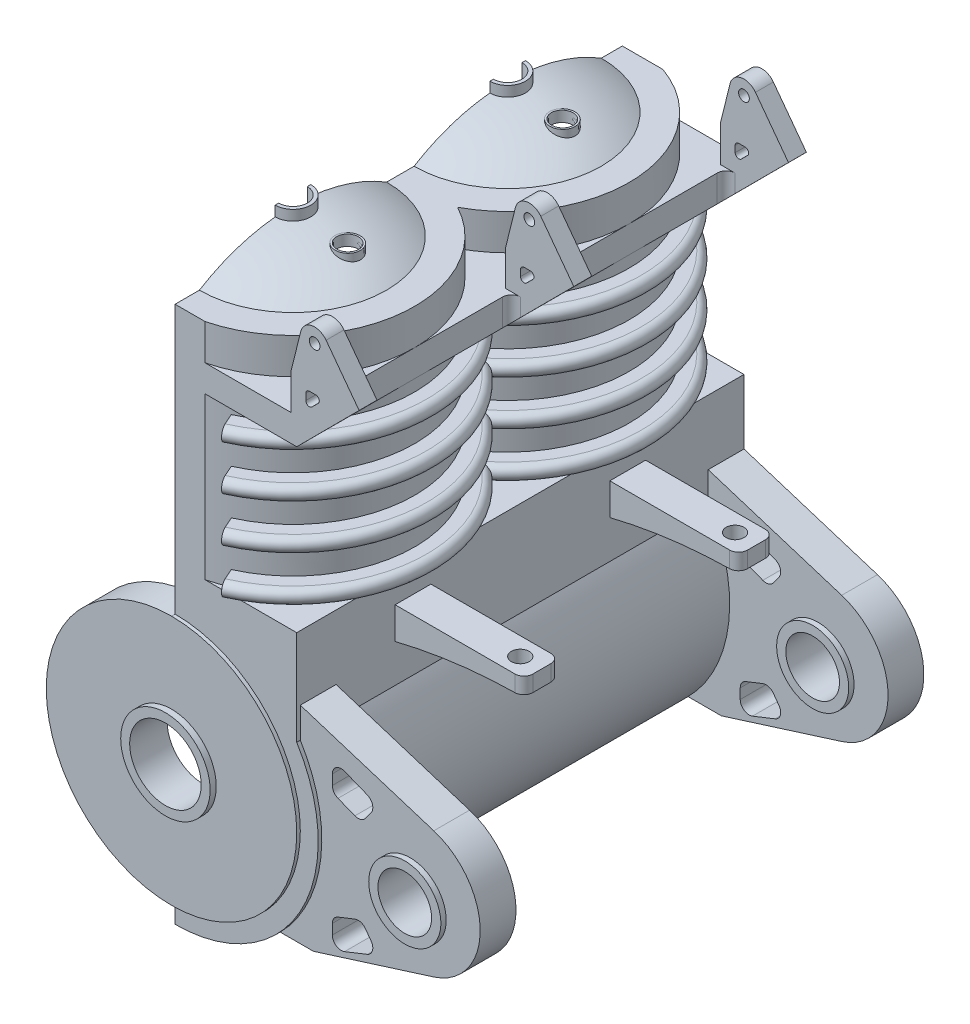
from build123d import *

# Parameters (mm, degrees)
BOSS_EXTRUDE1_DEPTH     = 25
SKETCH2_R               = 5
CUT_EXTRUDE1_DEPTH      = 20
SKETCH3_R               = 7
CUT_EXTRUDE2_DEPTH      = 39.394275615
CUT_EXTRUDE3_DEPTH      = 9
REVOLVE1_ANGLE          = 156
LPATTERN1_COUNT         = 2
LPATTERN1_PITCH         = 12
SKETCH6_R               = 5
CUT_EXTRUDE4_DEPTH      = 19
BOSS_EXTRUDE3_START     = -1
SKETCH7_R               = 7.001070091
SKETCH7_R_2             = 2.5
BOSS_EXTRUDE3_DEPTH     = 1.5
LPATTERN2_COUNT         = 3
LPATTERN2_PITCH         = 12
BOSS_EXTRUDE4_START     = 0.2
SKETCH8_R               = 2.5
BOSS_EXTRUDE4_DEPTH     = 0.2
BOSS_EXTRUDE5_START     = -1.6
SKETCH9_R               = 2.5
SKETCH9_R_2             = 2
BOSS_EXTRUDE5_DEPTH     = 2.1
LPATTERN3_COUNT         = 3
LPATTERN3_PITCH         = 12.22
BOSS_EXTRUDE6_START     = 2
BOSS_EXTRUDE6_DEPTH     = 2
SKETCH11_R              = 2.015
BOSS_EXTRUDE7_DEPTH     = 2
LPATTERN4_COUNT         = 2
LPATTERN4_PITCH         = 22.8
BOSS_EXTRUDE8_START     = 0.3
SKETCH12_R              = 2.015
SKETCH12_R_2            = 1.5
BOSS_EXTRUDE8_DEPTH     = 2.6
LPATTERN5_COUNT         = 2
LPATTERN5_PITCH         = 22.8
CUT_EXTRUDE5_DEPTH      = 43.908131966
CUT_EXTRUDE5_DEPTH_BACK = 43.908131966
REVOLVE2_ANGLE          = 180
LPATTERN6_COUNT         = 2
LPATTERN6_PITCH         = 12
SKETCH15_R              = 0.995
CUT_EXTRUDE6_DEPTH      = 43.908131896
BOSS_EXTRUDE9_START     = 1.2
BOSS_EXTRUDE9_DEPTH     = 0.8
SKETCH17_R              = 0.6
CUT_EXTRUDE7_DEPTH      = 10.8
SKETCH19_R              = 0.3
BOSS_EXTRUDE10_DEPTH    = 1
LPATTERN7_COUNT         = 3
LPATTERN7_PITCH         = 12
FILLET1_R               = 0.5
BOSS_EXTRUDE11_START    = -5.5
BOSS_EXTRUDE11_DEPTH    = 2
LPATTERN8_COUNT         = 2
LPATTERN8_PITCH         = 12
SKETCH21_R              = 0.5
CUT_EXTRUDE8_DEPTH      = 2
FILLET2_R               = 0.5
SKETCH22_W              = 4.85898412
SKETCH22_H              = 1.483894479
CUT_EXTRUDE9_DEPTH      = 45.833483211
SKETCH23_R              = 0.3
BOSS_EXTRUDE12_DEPTH    = 1
LPATTERN9_COUNT         = 3
LPATTERN9_PITCH         = 12
EXTRUDE_THIN1_START     = 0.6
EXTRUDE_THIN1_DEPTH     = 0.6


# Read off the part's stored shape, not the designer's step: Extrude-Thin1
with BuildPart() as part:
    # Sketch1 → Boss-Extrude1 (new body)
    with BuildSketch(Plane.XY):
        with BuildLine():
            Line((0, 28.02), (0, 0))
            ThreePointArc((0, 0), (6.989781542, 4.108605135), (6.8, 12.214261501))
            Line((6.8, 12.214261501), (6.8, 28.02))
            Line((6.8, 28.02), (0, 28.02))
        make_face()
    extrude(amount=BOSS_EXTRUDE1_DEPTH)

    # Sketch2 → Cut-Extrude1 (cut)
    with BuildSketch(Plane(origin=(0, 28.02, 0), x_dir=(1, 0, 0), z_dir=(0, 1, 0))):
        with Locations((0, -6.41)):
            Circle(SKETCH2_R)
        with Locations((0, -18.41)):
            Circle(SKETCH2_R)
    extrude(amount=-CUT_EXTRUDE1_DEPTH, mode=Mode.SUBTRACT)

    # Sketch3 → Cut-Extrude2 (cut, through all)
    with BuildSketch(Plane.XY.offset(25)):
        with Locations((0, 8.02)):
            Circle(SKETCH3_R)
    extrude(amount=-CUT_EXTRUDE2_DEPTH, mode=Mode.SUBTRACT)

    # Sketch4 → Cut-Extrude3 (cut)
    with BuildSketch(Plane(origin=(0, 26.52, 0), x_dir=(1, 0, 0), z_dir=(0, 1, 0))):
        with BuildLine():
            Line((0, 0.39), (13.311455152, 0.39))
            Line((13.311455152, 0.39), (13.311455152, -25.21))
            Line((13.311455152, -25.21), (0, -25.21))
            ThreePointArc((0, -25.21), (6.596969001, -20.05924225), (3.2, -12.41))
            ThreePointArc((3.2, -12.41), (6.596969001, -4.76075775), (0, 0.39))
        make_face()
    extrude(amount=-CUT_EXTRUDE3_DEPTH, mode=Mode.SUBTRACT)

    # Sketch5 → Revolve1 (revolve)
    with BuildSketch(Plane.ZY):
        with BuildLine():
            Line((0.17, 25.07), (0.17, 25.87))
            Line((0.17, 25.87), (-1.07, 25.87))
            ThreePointArc((-1.07, 25.87), (-1.47, 25.47), (-1.07, 25.07))
            Line((-1.07, 25.07), (0.17, 25.07))
        make_face()
        with BuildLine():
            Line((0.17, 22.57), (0.17, 23.37))
            Line((0.17, 23.37), (-1.07, 23.37))
            ThreePointArc((-1.07, 23.37), (-1.47, 22.97), (-1.07, 22.57))
            Line((-1.07, 22.57), (0.17, 22.57))
        make_face()
        with BuildLine():
            Line((-1.07, 17.57), (0.17, 17.57))
            Line((0.17, 17.57), (0.17, 18.37))
            Line((0.17, 18.37), (-1.07, 18.37))
            ThreePointArc((-1.07, 18.37), (-1.47, 17.97), (-1.07, 17.57))
        make_face()
        with BuildLine():
            Line((0.17, 20.07), (0.17, 20.87))
            Line((0.17, 20.87), (-1.07, 20.87))
            ThreePointArc((-1.07, 20.87), (-1.47, 20.47), (-1.07, 20.07))
            Line((-1.07, 20.07), (0.17, 20.07))
        make_face()
    revolve1 = revolve(axis=Axis((0, 28.02, 6.41), (0, -1, 0)), revolution_arc=REVOLVE1_ANGLE)

    # LPattern1: Revolve1 ×2
    with Locations(*[(0, 0, i * LPATTERN1_PITCH) for i in range(1, LPATTERN1_COUNT)]):
        add(revolve1)

    # Sketch6 → Cut-Extrude4 (cut)
    with BuildSketch(Plane(origin=(0, 28.02, 0), x_dir=(1, 0, 0), z_dir=(0, 1, 0))):
        with Locations((0, -6.41)):
            Circle(SKETCH6_R)
    extrude(amount=-CUT_EXTRUDE4_DEPTH, mode=Mode.SUBTRACT)

    # Sketch7 → Boss-Extrude3 (add)
    with BuildSketch(Plane(origin=(0, 0, 0), x_dir=(-1, 0, 0), z_dir=(0, 0, -1)).offset(BOSS_EXTRUDE3_START)):
        with Locations((0, 8.02)):
            Circle(SKETCH7_R)
        with Locations((0, 8.02)):
            Circle(SKETCH7_R_2, mode=Mode.SUBTRACT)
    boss_extrude3 = extrude(amount=BOSS_EXTRUDE3_DEPTH)

    # LPattern2: Boss-Extrude3 ×3
    with Locations(*[(0, 0, i * LPATTERN2_PITCH) for i in range(1, LPATTERN2_COUNT)]):
        add(boss_extrude3)

    # Sketch8 → Boss-Extrude4 (add)
    with BuildSketch(Plane.XY.offset(25).offset(BOSS_EXTRUDE4_START)):
        with BuildLine():
            Line((0, 15.02), (0, 15.021070091))
            ThreePointArc((0, 15.021070091), (-7.001070091, 8.02), (0, 1.018929909))
            Line((0, 1.018929909), (0, 1.02))
            ThreePointArc((0, 1.02), (7, 8.02), (0, 15.02))
        make_face()
        with Locations(Location((0, 8.02, 0), (0, 0, 180))):
            Circle(SKETCH8_R, mode=Mode.SUBTRACT)
    extrude(amount=-BOSS_EXTRUDE4_DEPTH)

    # Sketch9 → Boss-Extrude5 (add)
    with BuildSketch(Plane(origin=(0, 0, -0.5), x_dir=(-1, 0, 0), z_dir=(0, 0, -1)).offset(BOSS_EXTRUDE5_START)):
        with Locations((0, 8.02)):
            Circle(SKETCH9_R)
        with Locations((0, 8.02)):
            Circle(SKETCH9_R_2, mode=Mode.SUBTRACT)
    boss_extrude5 = extrude(amount=BOSS_EXTRUDE5_DEPTH)

    # LPattern3: Boss-Extrude5 ×3
    with Locations(*[(0, 0, i * LPATTERN3_PITCH) for i in range(1, LPATTERN3_COUNT)]):
        add(boss_extrude5)

    # Sketch10 → Boss-Extrude6 (add)
    with BuildSketch(Plane(origin=(0, 28.02, 0), x_dir=(1, 0, 0), z_dir=(0, 1, 0)).offset(BOSS_EXTRUDE6_START)):
        with BuildLine():
            Line((0, -13.41), (0, -11.41))
            ThreePointArc((0, -11.41), (5, -6.41), (0, -1.41))
            Line((0, -1.41), (0, 0))
            Line((0, 0), (2.269779725, 0))
            ThreePointArc((2.269779725, 0), (5.553129844, -2.485366395), (6.8, -6.41))
            ThreePointArc((6.8, -6.41), (5.830951895, -9.908571137), (3.2, -12.41))
            ThreePointArc((3.2, -12.41), (5.830951895, -14.911428863), (6.8, -18.41))
            ThreePointArc((6.8, -18.41), (5.368553353, -22.583563813), (1.676872088, -25))
            Line((1.676872088, -25), (0, -25))
            Line((0, -25), (0, -23.41))
            ThreePointArc((0, -23.41), (5, -18.41), (0, -13.41))
        make_face()
    extrude(amount=-BOSS_EXTRUDE6_DEPTH)

    # Sketch11 → Boss-Extrude7 (add)
    with BuildSketch(Plane(origin=(0, 0, 0), x_dir=(-1, 0, 0), z_dir=(0, 0, -1))):
        with BuildLine():
            Line((-6.8, 13.910696928), (-14.260881942, 11.558289887))
            ThreePointArc((-14.260881942, 11.558289887), (-16.855263426, 8.02), (-14.260881942, 4.481710113))
            Line((-14.260881942, 4.481710113), (-7.534562688, 2.360909798))
            Line((-7.534562688, 2.360909798), (-5.674562688, 2.360909798))
            ThreePointArc((-5.674562688, 2.360909798), (-7.948321427, 7.092152825), (-6.8, 12.214261501))
            Line((-6.8, 12.214261501), (-6.8, 13.910696928))
        make_face()
        with Locations((-12.94, 7.58)):
            Circle(SKETCH11_R, mode=Mode.SUBTRACT)
    boss_extrude7 = extrude(amount=-BOSS_EXTRUDE7_DEPTH)

    # LPattern4: Boss-Extrude7 ×2
    with Locations(*[(0, 0, i * LPATTERN4_PITCH) for i in range(1, LPATTERN4_COUNT)]):
        add(boss_extrude7)

    # Sketch12 → Boss-Extrude8 (add)
    with BuildSketch(Plane(origin=(0, 0, 0), x_dir=(-1, 0, 0), z_dir=(0, 0, -1)).offset(BOSS_EXTRUDE8_START)):
        with Locations((-12.94, 7.58)):
            Circle(SKETCH12_R)
        with Locations((-12.94, 7.58)):
            Circle(SKETCH12_R_2, mode=Mode.SUBTRACT)
    boss_extrude8 = extrude(amount=-BOSS_EXTRUDE8_DEPTH)

    # LPattern5: Boss-Extrude8 ×2
    with Locations(*[(0, 0, i * LPATTERN5_PITCH) for i in range(1, LPATTERN5_COUNT)]):
        add(boss_extrude8)

    # Sketch13 → Cut-Extrude5 (cut, two sides: drawn at the far end of the back side and taken through both)
    with BuildSketch(Plane(origin=(0, 0, 0), x_dir=(-1, 0, 0), z_dir=(0, 0, -1)).offset(-CUT_EXTRUDE5_DEPTH_BACK)):
        with BuildLine():
            Line((-9.274539991, 11.944182233), (-10.537427013, 11.44237282))
            ThreePointArc((-10.537427013, 11.44237282), (-10.833332956, 11.115847458), (-10.755995772, 10.68202941))
            Line((-10.755995772, 10.68202941), (-10.438459449, 10.249025334))
            ThreePointArc((-10.438459449, 10.249025334), (-10.173708226, 10.064258163), (-9.851232726, 10.079803859))
            Line((-9.851232726, 10.079803859), (-8.905882026, 10.454005178))
            ThreePointArc((-8.905882026, 10.454005178), (-8.676377466, 10.637849872), (-8.589906252, 10.918908484))
            Line((-8.589906252, 10.918908484), (-8.589906252, 11.479520655))
            ThreePointArc((-8.589906252, 11.479520655), (-8.80911885, 11.893233641), (-9.274539991, 11.944182233))
        make_face()
        with BuildLine():
            Line((-10.755995772, 4.47797059), (-10.438459449, 4.910974666))
            ThreePointArc((-10.438459449, 4.910974666), (-10.173708226, 5.095741837), (-9.851232726, 5.080196141))
            Line((-9.851232726, 5.080196141), (-8.905882026, 4.705994822))
            ThreePointArc((-8.905882026, 4.705994822), (-8.676377466, 4.522150128), (-8.589906252, 4.241091516))
            Line((-8.589906252, 4.241091516), (-8.589906252, 3.680479345))
            ThreePointArc((-8.589906252, 3.680479345), (-8.80911885, 3.266766359), (-9.274539991, 3.215817767))
            Line((-9.274539991, 3.215817767), (-10.537427013, 3.71762718))
            ThreePointArc((-10.537427013, 3.71762718), (-10.833332956, 4.044152542), (-10.755995772, 4.47797059))
        make_face()
    extrude(amount=CUT_EXTRUDE5_DEPTH + CUT_EXTRUDE5_DEPTH_BACK, mode=Mode.SUBTRACT)

    # Sketch14 → Revolve2 (revolve)
    with BuildSketch(Plane.ZY):
        with BuildLine():
            Line((18.41, 31.498591666), (18.41, 31.378591666))
            ThreePointArc((18.41, 31.378591666), (15.819354747, 31.032895897), (13.41, 30.02))
            Line((13.41, 30.02), (13.176874739, 30.02))
            ThreePointArc((13.176874739, 30.02), (15.691000491, 31.121846919), (18.41, 31.498591666))
        make_face()
    revolve2 = revolve(axis=Axis((0, 30.02, 18.41), (0, -1, 0)), revolution_arc=REVOLVE2_ANGLE)

    # LPattern6: Revolve2 ×2
    with Locations(*[(0, 0, -i * LPATTERN6_PITCH) for i in range(1, LPATTERN6_COUNT)]):
        add(revolve2)

    # Sketch15 → Cut-Extrude6 (cut, through all)
    with BuildSketch(Plane(origin=(0, 30.02, 0), x_dir=(1, 0, 0), z_dir=(0, 1, 0))):
        with Locations((0, -6.41)):
            Circle(SKETCH15_R)
        with Locations((0, -18.41)):
            Circle(SKETCH15_R)
    extrude(amount=CUT_EXTRUDE6_DEPTH, mode=Mode.SUBTRACT)

    # Sketch16 → Boss-Extrude9 (add)
    with BuildSketch(Plane(origin=(0, 30.02, 0), x_dir=(1, 0, 0), z_dir=(0, 1, 0)).offset(BOSS_EXTRUDE9_START)):
        with BuildLine():
            Line((0, -5.415), (0, -5.61))
            ThreePointArc((0, -5.61), (0.8, -6.41), (0, -7.21))
            Line((0, -7.21), (0, -7.405))
            ThreePointArc((0, -7.405), (0.995, -6.41), (0, -5.415))
        make_face()
        with BuildLine():
            Line((0, -19.405), (0, -19.21))
            ThreePointArc((0, -19.21), (0.8, -18.41), (0, -17.61))
            Line((0, -17.61), (0, -17.415))
            ThreePointArc((0, -17.415), (0.995, -18.41), (0, -19.405))
        make_face()
    extrude(amount=BOSS_EXTRUDE9_DEPTH)

    # Sketch17 → Cut-Extrude7 (cut)
    with BuildSketch(Plane(origin=(14.781964373, 17.616459147, 0), x_dir=(0, 0, 1), z_dir=(0.6427876096865406, 0.7660444431189771, -1.5357894129670808e-14))):
        with Locations(Location((6.41, -17.582059262, 0), (0, 0, 242.728829359))):
            Circle(SKETCH17_R)
        with Locations(Location((18.41, -17.582059262, 0), (0, 0, 242.728829359))):
            Circle(SKETCH17_R)
    extrude(amount=CUT_EXTRUDE7_DEPTH, mode=Mode.SUBTRACT)

    # Sketch19 → Boss-Extrude10 (add)
    with BuildSketch(Plane(origin=(0, 0, 0), x_dir=(-1, 0, 0), z_dir=(0, 0, -1))):
        with BuildLine():
            Line((-6.48, 30.02), (-6.48, 26.52))
            Line((-6.48, 26.52), (-6.8, 26.52))
            Line((-6.8, 26.52), (-10.769623837, 30.504747406))
            ThreePointArc((-10.769623837, 30.504747406), (-10.666737998, 31.247185622), (-9.924299782, 31.144299782))
            Line((-9.924299782, 31.144299782), (-8.8, 30.02))
            Line((-8.8, 30.02), (-6.48, 30.02))
        make_face()
        with Locations((-10.34696181, 30.824523594)):
            Circle(SKETCH19_R, mode=Mode.SUBTRACT)
        with BuildLine():
            Line((-8.001254794, 29.221254794), (-7.650621223, 28.870621223))
            ThreePointArc((-7.650621223, 28.870621223), (-7.43266318, 28.827266672), (-7.309199866, 29.012042579))
            Line((-7.309199866, 29.012042579), (-7.309199866, 29.36267615))
            ThreePointArc((-7.309199866, 29.36267615), (-7.36777851, 29.504097506), (-7.509199866, 29.56267615))
            Line((-7.509199866, 29.56267615), (-7.859833437, 29.56267615))
            ThreePointArc((-7.859833437, 29.56267615), (-8.044609344, 29.439212836), (-8.001254794, 29.221254794))
        make_face(mode=Mode.SUBTRACT)
    boss_extrude10 = extrude(amount=-BOSS_EXTRUDE10_DEPTH)

    # LPattern7: Boss-Extrude10 ×3
    with Locations(*[(0, 0, i * LPATTERN7_PITCH) for i in range(1, LPATTERN7_COUNT)]):
        add(boss_extrude10)

    # Fillet1
    fillet1_edges = [part.edges().sort_by_distance(p)[0] for p in [
        (6.8, 27.27, 1),
        (6.8, 27.27, 13),
        (6.8, 27.27, 12),
        (6.8, 27.27, 24),
    ]]
    fillet(fillet1_edges, radius=FILLET1_R)

    # Sketch20 → Boss-Extrude11 (add)
    with BuildSketch(Plane(origin=(0, 0, 0), x_dir=(-1, 0, 0), z_dir=(0, 0, -1)).offset(BOSS_EXTRUDE11_START)):
        with BuildLine():
            Line((-6.8, 16.12), (-14, 16.12))
            Line((-14, 16.12), (-14, 15.22))
            ThreePointArc((-14, 15.22), (-10.373403742, 14.999989919), (-6.8, 14.343186639))
            Line((-6.8, 14.343186639), (-6.8, 16.12))
        make_face()
    boss_extrude11 = extrude(amount=-BOSS_EXTRUDE11_DEPTH)

    # LPattern8: Boss-Extrude11 ×2
    with Locations(*[(0, 0, i * LPATTERN8_PITCH) for i in range(1, LPATTERN8_COUNT)]):
        add(boss_extrude11)

    # Sketch21 → Cut-Extrude8 (cut)
    with BuildSketch(Plane(origin=(0, 16.12, 0), x_dir=(1, 0, 0), z_dir=(0, 1, 0))):
        with Locations(Location((12.8, -6.5, 0), (0, 0, 270))):
            Circle(SKETCH21_R)
        with Locations(Location((12.8, -18.504938686, 0), (0, 0, 270))):
            Circle(SKETCH21_R)
    extrude(amount=-CUT_EXTRUDE8_DEPTH, mode=Mode.SUBTRACT)

    # Fillet2
    fillet2_edges = [part.edges().sort_by_distance(p)[0] for p in [
        (14, 15.67, 7.5),
        (14, 15.67, 5.5),
        (14, 15.67, 19.5),
        (14, 15.67, 17.5),
    ]]
    fillet(fillet2_edges, radius=FILLET2_R)

    # Sketch22 → Cut-Extrude9 (cut, through all)
    with BuildSketch(Plane.XY.offset(25)):
        with Locations((9.312015874, 30.76194724)):
            Rectangle(SKETCH22_W, SKETCH22_H)
    extrude(amount=-CUT_EXTRUDE9_DEPTH, mode=Mode.SUBTRACT)

    # Sketch23 → Boss-Extrude12 (add)
    with BuildSketch(Plane.XY.offset(25)):
        with BuildLine():
            Line((6.48, 30.02), (10.286716224, 30.02))
            Line((10.286716224, 30.02), (8.441646657, 32.497796576))
            ThreePointArc((8.441646657, 32.497796576), (7.642214115, 32.804285417), (7.023502573, 32.212488302))
            Line((7.023502573, 32.212488302), (6.48, 30.02))
        make_face()
        with Locations((7.8, 32.02)):
            Circle(SKETCH23_R, mode=Mode.SUBTRACT)
    boss_extrude12 = extrude(amount=-BOSS_EXTRUDE12_DEPTH)

    # LPattern9: Boss-Extrude12 ×3
    with Locations(*[(0, 0, -i * LPATTERN9_PITCH) for i in range(1, LPATTERN9_COUNT)]):
        add(boss_extrude12)

    # Extrude-Thin1 outline → Extrude-Thin1 (add)
    # profile 1 of 2: a face of its own
    with BuildSketch(Plane(origin=(0, 30.02, 0), x_dir=(1, 0, 0), z_dir=(0, 1, 0)).offset(EXTRUDE_THIN1_START)):
        with BuildLine():
            add(Edge.make_bspline(
                [(2.343640241, -18.449627455), (2.347001194, -18.51193123), (2.3586965, -18.573657714), (2.408853531, -18.719638955), (2.457480334, -18.801146564), (2.581635931, -18.93922218), (2.656359453, -18.995770309), (2.824631317, -19.077527823), (2.915076102, -19.101191006), (3.100459054, -19.114446955), (3.194151404, -19.10360695), (3.458383722, -19.019315757), (3.611846643, -18.892924649), (3.697756817, -18.726613481)],
                knots=[0.582908907, 0.582908907, 0.582908907, 0.582908907, 0.625, 0.625, 0.6875, 0.6875, 0.75, 0.75, 0.8125, 0.8125, 0.875, 0.875, 1, 1, 1, 1], degree=3))
            add(Edge.make_bspline(
                [(3.697756817, -18.726613481), (3.740711904, -18.643457898), (3.766011263, -18.553881263), (3.779860464, -18.368247571), (3.767622941, -18.274599811), (3.6779827, -18.012173083), (3.54361617, -17.863247605), (3.294462889, -17.742190527), (3.202887263, -17.71842309), (3.017587919, -17.705790608), (2.924675355, -17.716606131), (2.657964388, -17.802279821), (2.505338603, -17.928978833), (2.374534961, -18.179357562), (2.34903221, -18.275743653), (2.343685017, -18.373114431)],
                knots=[0, 0, 0, 0, 0.0625, 0.0625, 0.125, 0.125, 0.25, 0.25, 0.3125, 0.3125, 0.375, 0.375, 0.5, 0.5, 0.565706949, 0.565706949, 0.565706949, 0.565706949], degree=3))
            add(Edge.make_bspline(
                [(2.343685017, -18.373114431), (2.342285132, -18.39860592), (2.342266674, -18.424164898), (2.343640241, -18.449627455)],
                knots=[0.565706949, 0.565706949, 0.565706949, 0.565706949, 0.582908907, 0.582908907, 0.582908907, 0.582908907], degree=3))
        make_face()
        with BuildLine():
            add(Edge.make_bspline(
                [(2.508598294, -18.138703359), (2.432778835, -18.283339567), (2.421144083, -18.460146881), (2.535465595, -18.766761031), (2.655306002, -18.888226296), (2.940557676, -19.018106044), (3.10589897, -19.027404297), (3.402134327, -18.931676204), (3.534600289, -18.824573803), (3.646065555, -18.608791231), (3.668566347, -18.528580518), (3.678811043, -18.364795494), (3.666402892, -18.282168968), (3.582593466, -18.05475375), (3.462597475, -17.93106157), (3.179521161, -17.801901149), (3.013681622, -17.792766811), (2.717025375, -17.888623592), (2.584417753, -17.994067151), (2.508598294, -18.138703359)],
                knots=[0, 0, 0, 0, 0.125, 0.125, 0.25, 0.25, 0.375, 0.375, 0.5, 0.5, 0.5625, 0.5625, 0.625, 0.625, 0.75, 0.75, 0.875, 0.875, 1, 1, 1, 1], degree=3))
        make_face(mode=Mode.SUBTRACT)
    # profile 2 of 2: a face of its own
    with BuildSketch(Plane(origin=(0, 30.02, 0), x_dir=(1, 0, 0), z_dir=(0, 1, 0)).offset(EXTRUDE_THIN1_START)):
        with BuildLine():
            add(Edge.make_bspline(
                [(2.343640241, -6.449627455), (2.347001194, -6.51193123), (2.3586965, -6.573657714), (2.408853531, -6.719638955), (2.457480334, -6.801146564), (2.581635931, -6.93922218), (2.656359453, -6.995770309), (2.824631317, -7.077527823), (2.915076102, -7.101191006), (3.100459054, -7.114446955), (3.194151404, -7.10360695), (3.458383722, -7.019315757), (3.611846643, -6.892924649), (3.697756817, -6.726613481)],
                knots=[0.582908907, 0.582908907, 0.582908907, 0.582908907, 0.625, 0.625, 0.6875, 0.6875, 0.75, 0.75, 0.8125, 0.8125, 0.875, 0.875, 1, 1, 1, 1], degree=3))
            add(Edge.make_bspline(
                [(3.697756817, -6.726613481), (3.740711904, -6.643457898), (3.766011263, -6.553881263), (3.779860464, -6.368247571), (3.767622941, -6.274599811), (3.6779827, -6.012173083), (3.54361617, -5.863247605), (3.294462889, -5.742190527), (3.202887263, -5.71842309), (3.017587919, -5.705790608), (2.924675355, -5.716606131), (2.657964388, -5.802279821), (2.505338603, -5.928978833), (2.374534961, -6.179357562), (2.34903221, -6.275743653), (2.343685017, -6.373114431)],
                knots=[0, 0, 0, 0, 0.0625, 0.0625, 0.125, 0.125, 0.25, 0.25, 0.3125, 0.3125, 0.375, 0.375, 0.5, 0.5, 0.565706949, 0.565706949, 0.565706949, 0.565706949], degree=3))
            add(Edge.make_bspline(
                [(2.343685017, -6.373114431), (2.342285132, -6.39860592), (2.342266674, -6.424164898), (2.343640241, -6.449627455)],
                knots=[0.565706949, 0.565706949, 0.565706949, 0.565706949, 0.582908907, 0.582908907, 0.582908907, 0.582908907], degree=3))
        make_face()
        with BuildLine():
            add(Edge.make_bspline(
                [(2.508598294, -6.138703359), (2.432778835, -6.283339567), (2.421144083, -6.460146881), (2.535465595, -6.766761031), (2.655306002, -6.888226296), (2.940557676, -7.018106044), (3.10589897, -7.027404297), (3.402134327, -6.931676204), (3.534600289, -6.824573803), (3.646065555, -6.608791231), (3.668566347, -6.528580518), (3.678811043, -6.364795494), (3.666402892, -6.282168968), (3.582593466, -6.05475375), (3.462597475, -5.93106157), (3.179521161, -5.801901149), (3.013681622, -5.792766811), (2.717025375, -5.888623592), (2.584417753, -5.994067151), (2.508598294, -6.138703359)],
                knots=[0, 0, 0, 0, 0.125, 0.125, 0.25, 0.25, 0.375, 0.375, 0.5, 0.5, 0.5625, 0.5625, 0.625, 0.625, 0.75, 0.75, 0.875, 0.875, 1, 1, 1, 1], degree=3))
        make_face(mode=Mode.SUBTRACT)
    extrude(amount=EXTRUDE_THIN1_DEPTH)


solid = part.part
